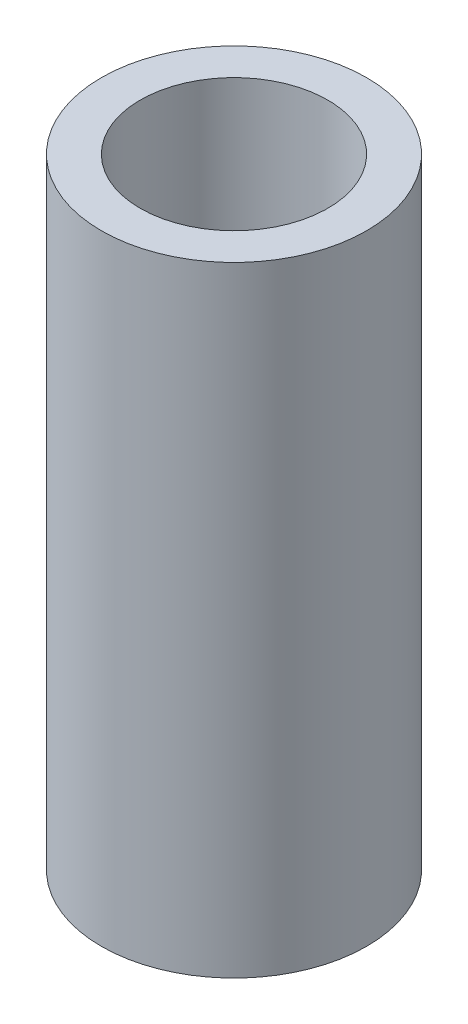
from build123d import *

# Parameters (mm, degrees)
SKETCH1_R           = 10
BOSS_EXTRUDE1_DEPTH = 46.729513907
SKETCH2_R           = 7.072998273
CUT_EXTRUDE1_DEPTH  = 49.822612282


with BuildPart() as part:
    # Sketch1 → Boss-Extrude1 (new body)
    with BuildSketch(Plane(origin=(0, 0, 0), x_dir=(1, 0, 0), z_dir=(0, 1, 0))):
        Circle(SKETCH1_R)
    extrude(amount=BOSS_EXTRUDE1_DEPTH)

    # Sketch2 → Cut-Extrude1 (cut, through all)
    with BuildSketch(Plane(origin=(0, 0, 0), x_dir=(1, 0, 0), z_dir=(0, 1, 0))):
        Circle(SKETCH2_R)
    extrude(amount=CUT_EXTRUDE1_DEPTH, mode=Mode.SUBTRACT)


solid = part.part
